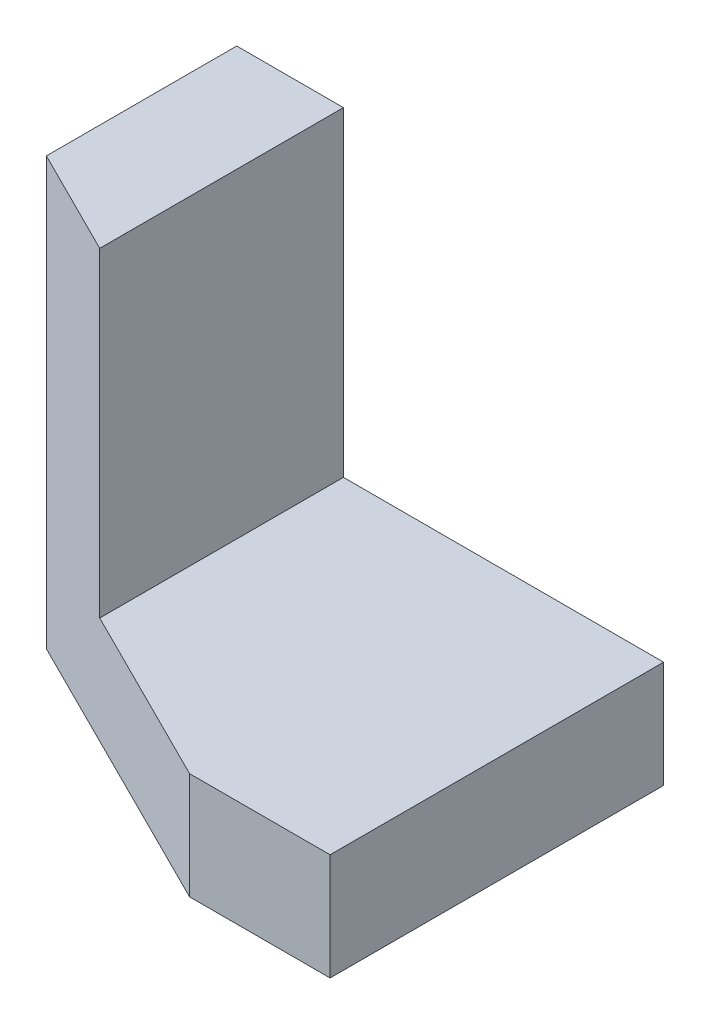
from build123d import *

# Parameters (mm, degrees)
BOSS_EXTRUDE1_DEPTH = 10.16
BOSS_EXTRUDE2_DEPTH = 40.64


with BuildPart() as part:
    # Sketch1 → Boss-Extrude1 (new body)
    with BuildSketch(Plane(origin=(0, 0, 0), x_dir=(1, 0, 0), z_dir=(0, 1, 0))):
        Polygon((0, 0), (0, 18.118929609), (27.262140782, 18.118929609), (40.64, 18.118929609), (40.64, -13.631070391), (27.262140782, -13.631070391), align=None)
    extrude(amount=BOSS_EXTRUDE1_DEPTH)

    # Sketch2 → Boss-Extrude2 (add)
    with BuildSketch(Plane(origin=(0, 0, 0), x_dir=(1, 0, 0), z_dir=(0, 1, 0))):
        Polygon((0, 18.118929609), (10.16, 18.118929609), (10.16, -5.08), (0, 0), align=None)
    extrude(amount=BOSS_EXTRUDE2_DEPTH)


solid = part.part
